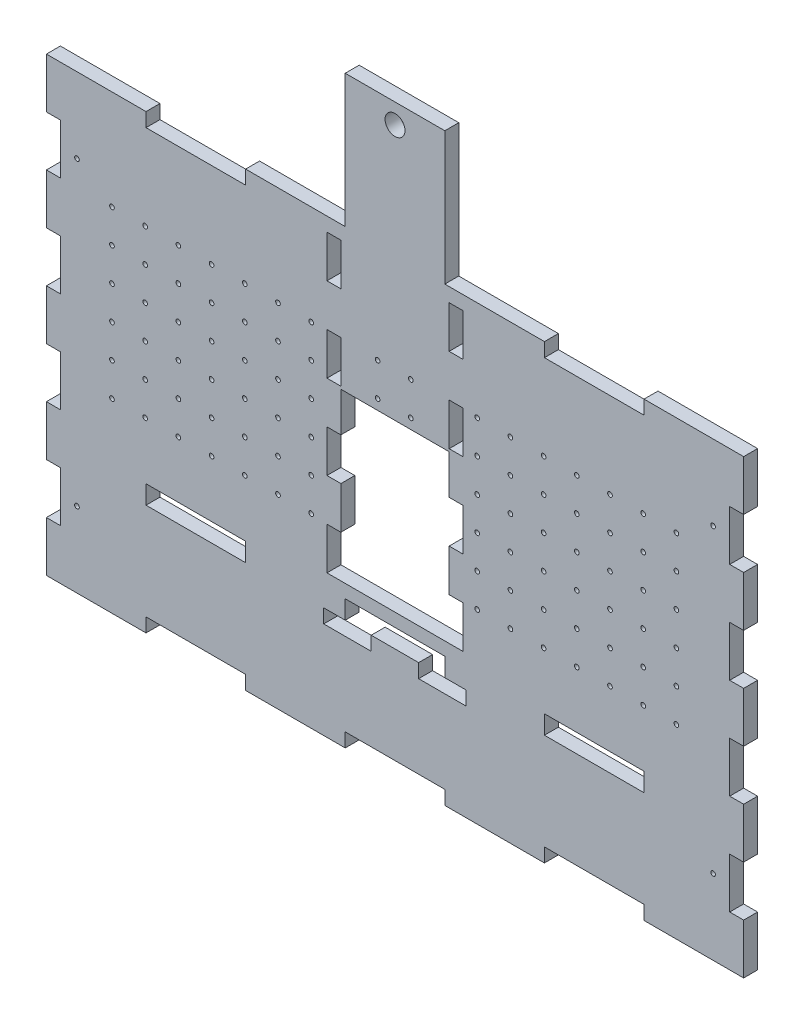
from build123d import *

# Parameters (mm, degrees)
SKETCH1_W           = 266.7
SKETCH1_H           = 172.72
BOSS_EXTRUDE1_DEPTH = 5.334
SKETCH2_W           = 38.1
SKETCH2_H           = 5.334
CUT_EXTRUDE1_DEPTH  = 165.701204222
SKETCH5_W           = 38.1
SKETCH5_H           = 7.112
CUT_EXTRUDE3_DEPTH  = 165.701204222
SKETCH8_W           = 18.149934459
SKETCH8_H           = 5.334
SKETCH8_W_2         = 18.14993446
CUT_EXTRUDE6_DEPTH  = 165.701204222
SKETCH9_W           = 5.334
SKETCH9_H           = 19.191111111
CUT_EXTRUDE7_DEPTH  = 165.701204222
SKETCH10_W          = 38.1
SKETCH10_H          = 5.334
BOSS_EXTRUDE2_DEPTH = 50.8
SKETCH11_W          = 6.604
SKETCH11_H          = 40.64
CUT_EXTRUDE8_DEPTH  = 197.710659379
SKETCH12_R          = 3.81
CUT_EXTRUDE9_DEPTH  = 197.710659379
SKETCH14_R          = 0.889
CUT_EXTRUDE11_DEPTH = 197.710659379
SKETCH15_W          = 6.604
SKETCH15_H          = 10.16
CUT_EXTRUDE12_DEPTH = 197.710659379
SKETCH16_W          = 41.402
SKETCH16_H          = 63.5
CUT_EXTRUDE13_DEPTH = 197.710659379
SKETCH17_W          = 5.334
SKETCH17_H          = 16.124650759
SKETCH17_H_2        = 16.124650758
CUT_EXTRUDE14_DEPTH = 197.710659379
SKETCH18_W          = 38.1
SKETCH18_H          = 56.134
BOSS_EXTRUDE3_DEPTH = 5.334
SKETCH19_W          = 34.756768033
SKETCH19_H          = 54.94363668
CUT_EXTRUDE15_DEPTH = 197.710659379
SKETCH20_R          = 3.81
CUT_EXTRUDE16_DEPTH = 197.710659379
SKETCH21_R          = 0.889
CUT_EXTRUDE17_DEPTH = 197.710659379


with BuildPart() as part:
    # Sketch1 → Boss-Extrude1 (new body)
    with BuildSketch(Plane.XY):
        with Locations((5.474099752, 2.104142138)):
            Rectangle(SKETCH1_W, SKETCH1_H)
    extrude(amount=BOSS_EXTRUDE1_DEPTH)

    # Sketch2 → Cut-Extrude1 (cut, through all)
    with BuildSketch(Plane.XY.offset(5.334)):
        with Locations((-70.725900248, -81.588857862)):
            Rectangle(SKETCH2_W, SKETCH2_H)
        with Locations((5.474099752, -81.588857862)):
            Rectangle(SKETCH2_W, SKETCH2_H)
        with Locations((81.674099752, -81.588857862)):
            Rectangle(SKETCH2_W, SKETCH2_H)
        with Locations((81.674099752, 85.797142138)):
            Rectangle(SKETCH2_W, SKETCH2_H)
        with Locations((5.474099752, 85.797142138)):
            Rectangle(SKETCH2_W, SKETCH2_H)
        with Locations((-70.725900248, 85.797142138)):
            Rectangle(SKETCH2_W, SKETCH2_H)
    extrude(amount=-CUT_EXTRUDE1_DEPTH, mode=Mode.SUBTRACT)

    # Sketch5 → Cut-Extrude3 (cut, through all)
    with BuildSketch(Plane.XY.offset(5.334)):
        with Locations((-70.725900248, -38.378413173)):
            Rectangle(SKETCH5_W, SKETCH5_H)
        with Locations((5.474099752, -38.378413173)):
            Rectangle(SKETCH5_W, SKETCH5_H)
        with Locations((81.674099752, -38.378413173)):
            Rectangle(SKETCH5_W, SKETCH5_H)
    extrude(amount=-CUT_EXTRUDE3_DEPTH, mode=Mode.SUBTRACT)

    # Sketch8 → Cut-Extrude6 (cut, through all)
    with BuildSketch(Plane.XY.offset(5.334)):
        with Locations((-12.722736397, -44.601413173)):
            Rectangle(SKETCH8_W, SKETCH8_H)
        with Locations((23.577132522, -44.601413173)):
            Rectangle(SKETCH8_W_2, SKETCH8_H)
    extrude(amount=-CUT_EXTRUDE6_DEPTH, mode=Mode.SUBTRACT)

    # Sketch9 → Cut-Extrude7 (cut, through all)
    with BuildSketch(Plane.XY.offset(5.334)):
        with Locations((-125.208900248, -55.469191196)):
            Rectangle(SKETCH9_W, SKETCH9_H)
        with Locations((-125.208900248, -17.086968973)):
            Rectangle(SKETCH9_W, SKETCH9_H)
        with Locations((-125.208900248, 21.295253249)):
            Rectangle(SKETCH9_W, SKETCH9_H)
        with Locations((-125.208900248, 59.677475472)):
            Rectangle(SKETCH9_W, SKETCH9_H)
        with Locations((136.157099752, 59.677475472)):
            Rectangle(SKETCH9_W, SKETCH9_H)
        with Locations((136.157099752, 21.295253249)):
            Rectangle(SKETCH9_W, SKETCH9_H)
        with Locations((136.157099752, -17.086968973)):
            Rectangle(SKETCH9_W, SKETCH9_H)
        with Locations((136.157099752, -55.469191196)):
            Rectangle(SKETCH9_W, SKETCH9_H)
    extrude(amount=-CUT_EXTRUDE7_DEPTH, mode=Mode.SUBTRACT)

    # Sketch10 → Boss-Extrude2 (add)
    with BuildSketch(Plane(origin=(0, 88.464142138, 0), x_dir=(1, 0, 0), z_dir=(0, 1, 0))):
        with Locations((43.574099752, -2.667)):
            Rectangle(SKETCH10_W, SKETCH10_H)
    extrude(amount=BOSS_EXTRUDE2_DEPTH)

    # Sketch11 → Cut-Extrude8 (cut, through all)
    with BuildSketch(Plane(origin=(0, 0, 0), x_dir=(-1, 0, 0), z_dir=(0, 0, -1))):
        with Locations((-27.826099752, 108.784142138)):
            Rectangle(SKETCH11_W, SKETCH11_H)
    extrude(amount=-CUT_EXTRUDE8_DEPTH, mode=Mode.SUBTRACT)

    # Sketch12 → Cut-Extrude9 (cut, through all)
    with BuildSketch(Plane.XY.offset(5.334)):
        with Locations((43.574099752, 130.476471297)):
            Circle(SKETCH12_R)
    extrude(amount=-CUT_EXTRUDE9_DEPTH, mode=Mode.SUBTRACT)

    # Sketch14 → Cut-Extrude11 (cut, through all)
    with BuildSketch(Plane.XY.offset(5.334)):
        with Locations((-102.797588144, 50.364142138)):
            Circle(SKETCH14_R)
        with Locations((-90.097588144, 50.364142138)):
            Circle(SKETCH14_R)
        with Locations((-77.397588144, 50.364142138)):
            Circle(SKETCH14_R)
        with Locations((-64.697588144, 50.364142138)):
            Circle(SKETCH14_R)
        with Locations((-51.997588144, 50.364142138)):
            Circle(SKETCH14_R)
        with Locations((-39.297588144, 50.364142138)):
            Circle(SKETCH14_R)
        with Locations((-26.597588144, 50.364142138)):
            Circle(SKETCH14_R)
        with Locations((-1.197588144, 50.364142138)):
            Circle(SKETCH14_R)
        with Locations((11.502411856, 50.364142138)):
            Circle(SKETCH14_R)
        with Locations((36.902411856, 50.364142138)):
            Circle(SKETCH14_R)
        with Locations((49.602411856, 50.364142138)):
            Circle(SKETCH14_R)
        with Locations((62.302411856, 50.364142138)):
            Circle(SKETCH14_R)
        with Locations((75.002411856, 50.364142138)):
            Circle(SKETCH14_R)
        with Locations((87.702411856, 50.364142138)):
            Circle(SKETCH14_R)
        with Locations((100.402411856, 50.364142138)):
            Circle(SKETCH14_R)
        with Locations((113.102411856, 50.364142138)):
            Circle(SKETCH14_R)
        with Locations((-102.797588144, 37.664142138)):
            Circle(SKETCH14_R)
        with Locations((-90.097588144, 37.664142138)):
            Circle(SKETCH14_R)
        with Locations((-77.397588144, 37.664142138)):
            Circle(SKETCH14_R)
        with Locations((-64.697588144, 37.664142138)):
            Circle(SKETCH14_R)
        with Locations((-51.997588144, 37.664142138)):
            Circle(SKETCH14_R)
        with Locations((-39.297588144, 37.664142138)):
            Circle(SKETCH14_R)
        with Locations((-26.597588144, 37.664142138)):
            Circle(SKETCH14_R)
        with Locations((-1.197588144, 37.664142138)):
            Circle(SKETCH14_R)
        with Locations((11.502411856, 37.664142138)):
            Circle(SKETCH14_R)
        with Locations((36.902411856, 37.664142138)):
            Circle(SKETCH14_R)
        with Locations((49.602411856, 37.664142138)):
            Circle(SKETCH14_R)
        with Locations((62.302411856, 37.664142138)):
            Circle(SKETCH14_R)
        with Locations((75.002411856, 37.664142138)):
            Circle(SKETCH14_R)
        with Locations((87.702411856, 37.664142138)):
            Circle(SKETCH14_R)
        with Locations((100.402411856, 37.664142138)):
            Circle(SKETCH14_R)
        with Locations((113.102411856, 37.664142138)):
            Circle(SKETCH14_R)
        with Locations((-102.797588144, 24.964142138)):
            Circle(SKETCH14_R)
        with Locations((-90.097588144, 24.964142138)):
            Circle(SKETCH14_R)
        with Locations((-77.397588144, 24.964142138)):
            Circle(SKETCH14_R)
        with Locations((-64.697588144, 24.964142138)):
            Circle(SKETCH14_R)
        with Locations((-51.997588144, 24.964142138)):
            Circle(SKETCH14_R)
        with Locations((-39.297588144, 24.964142138)):
            Circle(SKETCH14_R)
        with Locations((-26.597588144, 24.964142138)):
            Circle(SKETCH14_R)
        with Locations((-1.197588144, 24.964142138)):
            Circle(SKETCH14_R)
        with Locations((11.502411856, 24.964142138)):
            Circle(SKETCH14_R)
        with Locations((36.902411856, 24.964142138)):
            Circle(SKETCH14_R)
        with Locations((49.602411856, 24.964142138)):
            Circle(SKETCH14_R)
        with Locations((62.302411856, 24.964142138)):
            Circle(SKETCH14_R)
        with Locations((75.002411856, 24.964142138)):
            Circle(SKETCH14_R)
        with Locations((87.702411856, 24.964142138)):
            Circle(SKETCH14_R)
        with Locations((100.402411856, 24.964142138)):
            Circle(SKETCH14_R)
        with Locations((113.102411856, 24.964142138)):
            Circle(SKETCH14_R)
        with Locations((-102.797588144, 12.264142138)):
            Circle(SKETCH14_R)
        with Locations((-90.097588144, 12.264142138)):
            Circle(SKETCH14_R)
        with Locations((-77.397588144, 12.264142138)):
            Circle(SKETCH14_R)
        with Locations((-64.697588144, 12.264142138)):
            Circle(SKETCH14_R)
        with Locations((-51.997588144, 12.264142138)):
            Circle(SKETCH14_R)
        with Locations((-39.297588144, 12.264142138)):
            Circle(SKETCH14_R)
        with Locations((-26.597588144, 12.264142138)):
            Circle(SKETCH14_R)
        with Locations((36.902411856, 12.264142138)):
            Circle(SKETCH14_R)
        with Locations((49.602411856, 12.264142138)):
            Circle(SKETCH14_R)
        with Locations((62.302411856, 12.264142138)):
            Circle(SKETCH14_R)
        with Locations((75.002411856, 12.264142138)):
            Circle(SKETCH14_R)
        with Locations((87.702411856, 12.264142138)):
            Circle(SKETCH14_R)
        with Locations((100.402411856, 12.264142138)):
            Circle(SKETCH14_R)
        with Locations((113.102411856, 12.264142138)):
            Circle(SKETCH14_R)
        with Locations((-102.797588144, -0.435857862)):
            Circle(SKETCH14_R)
        with Locations((-90.097588144, -0.435857862)):
            Circle(SKETCH14_R)
        with Locations((-77.397588144, -0.435857862)):
            Circle(SKETCH14_R)
        with Locations((-64.697588144, -0.435857862)):
            Circle(SKETCH14_R)
        with Locations((-51.997588144, -0.435857862)):
            Circle(SKETCH14_R)
        with Locations((-39.297588144, -0.435857862)):
            Circle(SKETCH14_R)
        with Locations((-26.597588144, -0.435857862)):
            Circle(SKETCH14_R)
        with Locations((-13.897588144, -0.435857862)):
            Circle(SKETCH14_R)
        with Locations((-1.197588144, -0.435857862)):
            Circle(SKETCH14_R)
        with Locations((11.502411856, -0.435857862)):
            Circle(SKETCH14_R)
        with Locations((24.202411856, -0.435857862)):
            Circle(SKETCH14_R)
        with Locations((36.902411856, -0.435857862)):
            Circle(SKETCH14_R)
        with Locations((49.602411856, -0.435857862)):
            Circle(SKETCH14_R)
        with Locations((62.302411856, -0.435857862)):
            Circle(SKETCH14_R)
        with Locations((75.002411856, -0.435857862)):
            Circle(SKETCH14_R)
        with Locations((87.702411856, -0.435857862)):
            Circle(SKETCH14_R)
        with Locations((100.402411856, -0.435857862)):
            Circle(SKETCH14_R)
        with Locations((113.102411856, -0.435857862)):
            Circle(SKETCH14_R)
        with Locations((-102.797588144, -13.135857862)):
            Circle(SKETCH14_R)
        with Locations((-90.097588144, -13.135857862)):
            Circle(SKETCH14_R)
        with Locations((-77.397588144, -13.135857862)):
            Circle(SKETCH14_R)
        with Locations((-64.697588144, -13.135857862)):
            Circle(SKETCH14_R)
        with Locations((-51.997588144, -13.135857862)):
            Circle(SKETCH14_R)
        with Locations((-39.297588144, -13.135857862)):
            Circle(SKETCH14_R)
        with Locations((-26.597588144, -13.135857862)):
            Circle(SKETCH14_R)
        with Locations((-13.897588144, -13.135857862)):
            Circle(SKETCH14_R)
        with Locations((-1.197588144, -13.135857862)):
            Circle(SKETCH14_R)
        with Locations((11.502411856, -13.135857862)):
            Circle(SKETCH14_R)
        with Locations((24.202411856, -13.135857862)):
            Circle(SKETCH14_R)
        with Locations((36.902411856, -13.135857862)):
            Circle(SKETCH14_R)
        with Locations((49.602411856, -13.135857862)):
            Circle(SKETCH14_R)
        with Locations((62.302411856, -13.135857862)):
            Circle(SKETCH14_R)
        with Locations((75.002411856, -13.135857862)):
            Circle(SKETCH14_R)
        with Locations((87.702411856, -13.135857862)):
            Circle(SKETCH14_R)
        with Locations((100.402411856, -13.135857862)):
            Circle(SKETCH14_R)
        with Locations((113.102411856, -13.135857862)):
            Circle(SKETCH14_R)
    extrude(amount=-CUT_EXTRUDE11_DEPTH, mode=Mode.SUBTRACT)

    # Sketch15 → Cut-Extrude12 (cut, through all)
    with BuildSketch(Plane.XY.offset(5.334)):
        with Locations((27.826099752, 134.184142138)):
            Rectangle(SKETCH15_W, SKETCH15_H)
    extrude(amount=-CUT_EXTRUDE12_DEPTH, mode=Mode.SUBTRACT)

    # Sketch16 → Cut-Extrude13 (cut, through all)
    with BuildSketch(Plane.XY.offset(5.334)):
        with Locations((5.474099752, 2.007586827)):
            Rectangle(SKETCH16_W, SKETCH16_H)
    extrude(amount=-CUT_EXTRUDE13_DEPTH, mode=Mode.SUBTRACT)

    # Sketch17 → Cut-Extrude14 (cut, through all)
    with BuildSketch(Plane.XY.offset(5.334)):
        with Locations((-17.893900248, -21.680087794)):
            Rectangle(SKETCH17_W, SKETCH17_H)
        with Locations((-17.893900248, 10.569213724)):
            Rectangle(SKETCH17_W, SKETCH17_H)
        with Locations((-17.893900248, 42.818515241)):
            Rectangle(SKETCH17_W, SKETCH17_H_2)
        with Locations((-17.893900248, 75.067816759)):
            Rectangle(SKETCH17_W, SKETCH17_H)
        with Locations((28.842099752, 75.067816759)):
            Rectangle(SKETCH17_W, SKETCH17_H)
        with Locations((28.842099752, 42.818515241)):
            Rectangle(SKETCH17_W, SKETCH17_H_2)
        with Locations((28.842099752, 10.569213724)):
            Rectangle(SKETCH17_W, SKETCH17_H)
        with Locations((28.842099752, -21.680087794)):
            Rectangle(SKETCH17_W, SKETCH17_H)
    extrude(amount=-CUT_EXTRUDE14_DEPTH, mode=Mode.SUBTRACT)

    # Sketch18 → Boss-Extrude3 (add)
    with BuildSketch(Plane.XY.offset(5.334)):
        with Locations((5.474099752, 111.197142138)):
            Rectangle(SKETCH18_W, SKETCH18_H)
    extrude(amount=-BOSS_EXTRUDE3_DEPTH)

    # Sketch19 → Cut-Extrude15 (cut, through all)
    with BuildSketch(Plane.XY.offset(5.334)):
        with Locations((48.506483768, 115.935960478)):
            Rectangle(SKETCH19_W, SKETCH19_H)
    extrude(amount=-CUT_EXTRUDE15_DEPTH, mode=Mode.SUBTRACT)

    # Sketch20 → Cut-Extrude16 (cut, through all)
    with BuildSketch(Plane.XY.offset(5.334)):
        with Locations((5.474099752, 131.644142138)):
            Circle(SKETCH20_R)
    extrude(amount=-CUT_EXTRUDE16_DEPTH, mode=Mode.SUBTRACT)

    # Sketch21 → Cut-Extrude17 (cut, through all)
    with BuildSketch(Plane.XY.offset(5.334)):
        with Locations((127.140099752, 59.677475471)):
            Circle(SKETCH21_R)
        with Locations((-116.191900248, 59.677475471)):
            Circle(SKETCH21_R)
        with Locations((-116.191900248, -55.469191196)):
            Circle(SKETCH21_R)
        with Locations((127.140099752, -55.469191196)):
            Circle(SKETCH21_R)
    extrude(amount=-CUT_EXTRUDE17_DEPTH, mode=Mode.SUBTRACT)


solid = part.part
